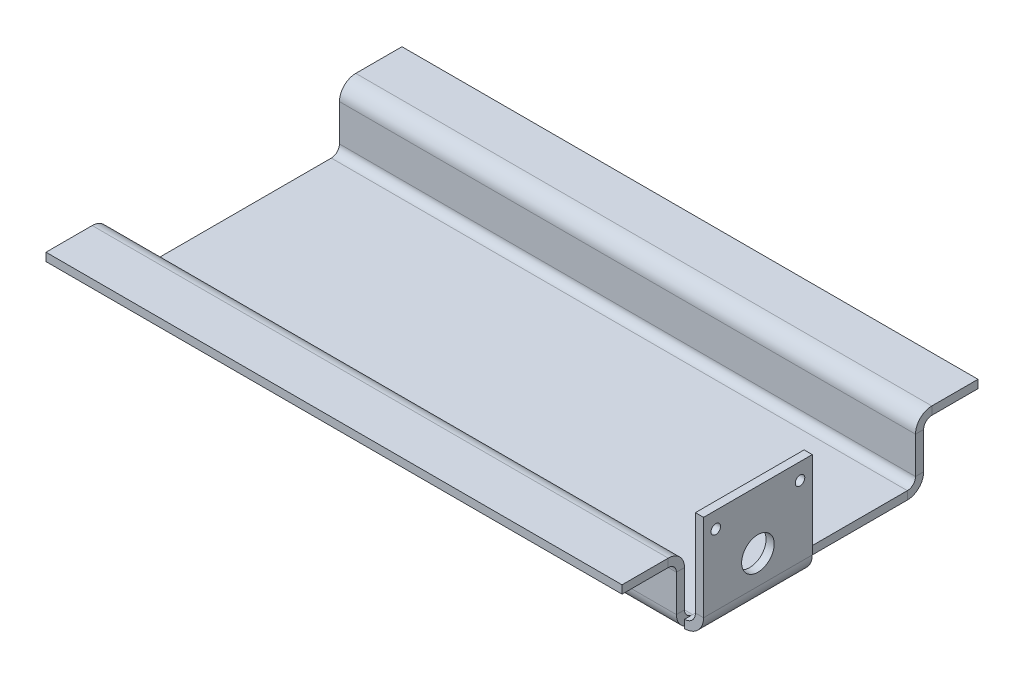
from build123d import *

# Parameters (mm, degrees)
BASE_FLANGE1_DEPTH            = 3
EDGE_FLANGE1_STRIP_W          = 20
EDGE_FLANGE1_STRIP_H          = 3
EDGE_FLANGE1_STRIP_CUT_DEPTH  = 40
EDGE_FLANGE1_RELIEF_W         = 21.5
EDGE_FLANGE1_RELIEF_H         = 1.5
EDGE_FLANGE1_RELIEF_CUT_DEPTH = 3
EDGE_FLANGE1_DEPTH            = 40
SKETCH10_R                    = 1.75
SKETCH10_R_2                  = 6
CUT_EXTRUDE1_DEPTH            = 226.971790275
EDGE_FLANGE2_STRIP_W          = 18
EDGE_FLANGE2_STRIP_H          = 3
EDGE_FLANGE2_STRIP_CUT_DEPTH  = 212
EDGE_FLANGE2_DEPTH            = 212
EDGE_FLANGE3_STRIP_W          = 18
EDGE_FLANGE3_STRIP_H          = 3
EDGE_FLANGE3_STRIP_CUT_DEPTH  = 212
EDGE_FLANGE3_DEPTH            = 212
MIRROR1_START                 = -107.5
MIRROR1_DEPTH                 = 213.5
MIRROR1_START_2               = 104.5
MIRROR1_2_DEPTH               = 1.5
MIRROR1_3_DEPTH               = 212
CUT_EXTRUDE2_DEPTH            = 10


# Read off the part's stored shape, not the designer's step: Mirror1
# Sheet-metal steps are written as plain solids
with BuildPart() as part:
    # Sketch1 → Base-Flange1 (new body)
    with BuildSketch(Plane(origin=(0, 0, 0), x_dir=(1, 0, 0), z_dir=(0, 1, 0))):
        Polygon((-107.5, -42.5), (108.5, -42.5), (108.5, -2.5), (107.5, -2.5), (107.5, 42.5), (-107.5, 42.5), align=None)
    extrude(amount=-BASE_FLANGE1_DEPTH)

    # Edge-Flange1 strip (across the edge) → Edge-Flange1 strip cut (cut)
    with BuildSketch(Plane(origin=(108.5, 0, 42.5), x_dir=(-1, 0, 0), z_dir=(0, 0, -1))):
        with Locations((-6, -1.5)):
            Rectangle(EDGE_FLANGE1_STRIP_W, EDGE_FLANGE1_STRIP_H)
    extrude(amount=EDGE_FLANGE1_STRIP_CUT_DEPTH, mode=Mode.SUBTRACT)

    # Edge-Flange1 relief (on the sheet) → Edge-Flange1 relief cut (cut)
    with BuildSketch(Plane(origin=(104.5, 0, 42.5), x_dir=(-1, 0, 0), z_dir=(0, 1, 0))):
        with Locations((-9.25, -40.75)):
            Rectangle(EDGE_FLANGE1_RELIEF_W, EDGE_FLANGE1_RELIEF_H)
    extrude(amount=-EDGE_FLANGE1_RELIEF_CUT_DEPTH, mode=Mode.SUBTRACT)

    # Edge-Flange1 section (across the edge) → Edge-Flange1 (add)
    with BuildSketch(Plane(origin=(108.5, 0, 42.5), x_dir=(-1, 0, 0), z_dir=(0, 0, -1))):
        with BuildLine():
            Line((-3, 4), (-3, 36))
            Line((-3, 36), (0, 36))
            Line((0, 36), (0, 4))
            ThreePointArc((0, 4), (1.171572875, 1.171572875), (4, 0))
            Line((4, 0), (4, -3))
            ThreePointArc((4, -3), (-0.949747468, -0.949747468), (-3, 4))
        make_face()
    extrude(amount=EDGE_FLANGE1_DEPTH)

    # Sketch10 → Cut-Extrude1 (cut, through all)
    with BuildSketch(Plane(origin=(111.5, 0, 0), x_dir=(0, 0, -1), z_dir=(1, 0, 0))):
        with Locations(Location((-38, 30, 0), (0, 0, 90))):
            Circle(SKETCH10_R)
        with Locations(Location((-7, 30, 0), (0, 0, 90))):
            Circle(SKETCH10_R)
        with Locations(Location((-22.5, 14.5, 0), (0, 0, 90))):
            Circle(SKETCH10_R_2)
    extrude(amount=-CUT_EXTRUDE1_DEPTH, mode=Mode.SUBTRACT)

    # Edge-Flange2 strip (across the edge) → Edge-Flange2 strip cut (cut)
    with BuildSketch(Plane(origin=(-107.5, 0, 42.5), x_dir=(0, 0, -1), z_dir=(1, 0, 0))):
        with Locations((-6, -1.5)):
            Rectangle(EDGE_FLANGE2_STRIP_W, EDGE_FLANGE2_STRIP_H)
    extrude(amount=EDGE_FLANGE2_STRIP_CUT_DEPTH, mode=Mode.SUBTRACT)

    # Edge-Flange2 section (across the edge) → Edge-Flange2 (add)
    with BuildSketch(Plane(origin=(-107.5, 0, 42.5), x_dir=(0, 0, -1), z_dir=(1, 0, 0))):
        with BuildLine():
            Line((-3, 3), (-3, 19.5))
            Line((-3, 19.5), (0, 19.5))
            Line((0, 19.5), (0, 3))
            ThreePointArc((0, 3), (0.878679656, 0.878679656), (3, 0))
            Line((3, 0), (3, -3))
            ThreePointArc((3, -3), (-1.242640687, -1.242640687), (-3, 3))
        make_face()
    extrude(amount=EDGE_FLANGE2_DEPTH)

    # Edge-Flange3 strip (across the edge) → Edge-Flange3 strip cut (cut)
    with BuildSketch(Plane(origin=(104.5, 19.5, 45.5), x_dir=(0, -1, 0), z_dir=(-1, 0, 0))):
        with Locations((-6, -1.5)):
            Rectangle(EDGE_FLANGE3_STRIP_W, EDGE_FLANGE3_STRIP_H)
    extrude(amount=EDGE_FLANGE3_STRIP_CUT_DEPTH, mode=Mode.SUBTRACT)

    # Edge-Flange3 section (across the edge) → Edge-Flange3 (add)
    with BuildSketch(Plane(origin=(104.5, 19.5, 45.5), x_dir=(0, -1, 0), z_dir=(-1, 0, 0))):
        with BuildLine():
            Line((-3, 3), (-3, 20))
            Line((-3, 20), (0, 20))
            Line((0, 20), (0, 3))
            ThreePointArc((0, 3), (0.878679656, 0.878679656), (3, 0))
            Line((3, 0), (3, -3))
            ThreePointArc((3, -3), (-1.242640687, -1.242640687), (-3, 3))
        make_face()
    extrude(amount=EDGE_FLANGE3_DEPTH)

    # Mirror1 outline → Mirror1 (cut)
    with BuildSketch(Plane.YZ.offset(MIRROR1_START)):
        with BuildLine():
            Line((-3, -42.5), (-2.196152423, -42.5))
            ThreePointArc((-2.196152423, -42.5), (-2.795554958, -41.052914271), (-3, -39.5))
            Line((-3, -39.5), (-3, -42.5))
        make_face()
    extrude(amount=MIRROR1_DEPTH, mode=Mode.SUBTRACT)

    # Mirror1 2 outline → Mirror1 2 (cut)
    with BuildSketch(Plane.YZ.offset(MIRROR1_START_2)):
        with BuildLine():
            ThreePointArc((-3, -39.5), (-2.795554958, -41.052914271), (-2.196152423, -42.5))
            Line((-2.196152423, -42.5), (0, -42.5))
            Line((0, -42.5), (0, -38))
            Line((0, -38), (-3, -38))
            Line((-3, -38), (-3, -39.5))
        make_face()
    extrude(amount=MIRROR1_2_DEPTH, mode=Mode.SUBTRACT)

    # Mirror1 3 outline → Mirror1 3 (add)
    with BuildSketch(Plane.YZ.offset(MIRROR1_START)):
        with BuildLine():
            Line((3, -45.5), (16.5, -45.5))
            ThreePointArc((16.5, -45.5), (18.621320344, -46.378679656), (19.5, -48.5))
            Line((19.5, -48.5), (19.5, -65.5))
            Line((19.5, -65.5), (22.5, -65.5))
            Line((22.5, -65.5), (22.5, -48.5))
            ThreePointArc((22.5, -48.5), (20.742640687, -44.257359313), (16.5, -42.5))
            Line((16.5, -42.5), (3, -42.5))
            ThreePointArc((3, -42.5), (0.878679656, -41.621320344), (0, -39.5))
            Line((0, -39.5), (0, -42.5))
            Line((0, -42.5), (-2.196152423, -42.5))
            ThreePointArc((-2.196152423, -42.5), (0, -44.696152423), (3, -45.5))
        make_face()
    extrude(amount=MIRROR1_3_DEPTH)

    # Sketch19 → Cut-Extrude2 (cut)
    with BuildSketch(Plane(origin=(0, 0, 0), x_dir=(1, 0, 0), z_dir=(0, 1, 0))):
        Polygon((107.5, -1), (107.5, 42.5), (106, 42.5), (104.5, 38), (104.5, -1), align=None)
    extrude(amount=-CUT_EXTRUDE2_DEPTH, mode=Mode.SUBTRACT)


solid = part.part
